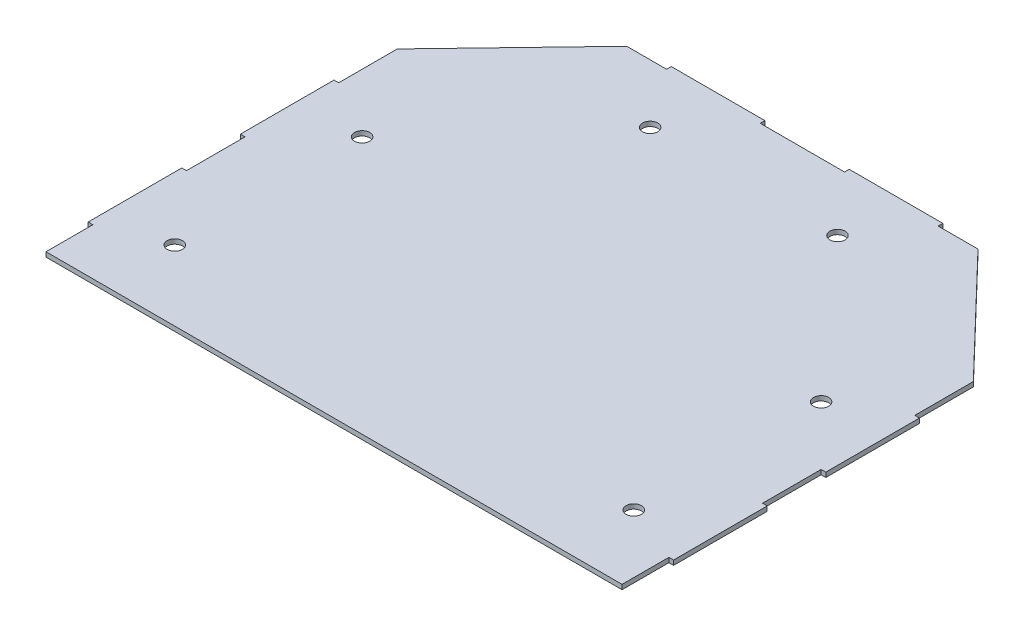
from build123d import *

# Parameters (mm, degrees)
BOSS_EXTRUDE1_DEPTH = 2
SKETCH2_R           = 3.25
CUT_EXTRUDE1_DEPTH  = 238.556309114


with BuildPart() as part:
    # Sketch1 → Boss-Extrude1 (new body)
    with BuildSketch(Plane(origin=(0, 0, 0), x_dir=(1, 0, 0), z_dir=(0, 1, 0))):
        Polygon((-123, 20), (-123, 0), (123, 0), (123, 20), (125, 20), (125, 60), (123, 60), (123, 85), (125, 85), (125, 125), (123, 125), (123, 150), (75, 200), (58, 200), (58, 202), (18, 202), (18, 200), (-18, 200), (-18, 202), (-58, 202), (-58, 200), (-75, 200), (-123, 150), (-123, 125), (-125, 125), (-125, 85), (-123, 85), (-123, 60), (-125, 60), (-125, 20), align=None)
    extrude(amount=BOSS_EXTRUDE1_DEPTH)

    # Sketch2 → Cut-Extrude1 (cut, through all)
    with BuildSketch(Plane(origin=(0, 2, 0), x_dir=(-1, 0, 0), z_dir=(0, 1, 0))):
        with Locations((98, -110)):
            Circle(SKETCH2_R)
        with Locations((98, -30)):
            Circle(SKETCH2_R)
        with Locations((-98, -30)):
            Circle(SKETCH2_R)
        with Locations((-98, -110)):
            Circle(SKETCH2_R)
        with Locations((40, -175)):
            Circle(SKETCH2_R)
        with Locations((-40, -175)):
            Circle(SKETCH2_R)
    extrude(amount=-CUT_EXTRUDE1_DEPTH, mode=Mode.SUBTRACT)


solid = part.part
